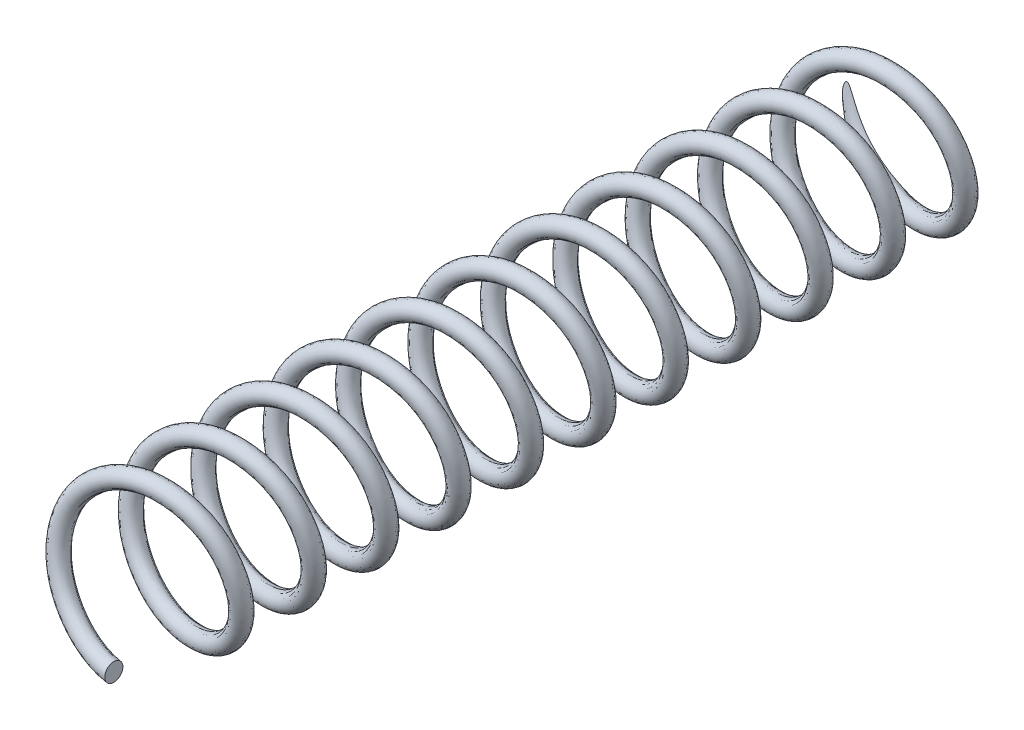
from build123d import *

# Parameters (mm, degrees)
SWEEP1_PITCH       = 1.016
SKETCH16_W         = 43.713001351
SKETCH16_H         = 11.417527284
CUT_EXTRUDE1_DEPTH = 1.27


with BuildPart() as part:
    # Sweep1: the profile of Sketch5 screwed along a right-hand helix of 50 turns, 6 arcs to a turn; built about Z, then put on its axis
    sweep1_z = Axis((0, 0, 0), (0, 0, 1))
    sweep1_corners = [(1.014478483, 0, 0.127), (0.887478483, 0, 0), (1.014478483, 0, -0.127), (1.141478483, 0, 0)]
    with BuildLine(mode=Mode.PRIVATE) as sweep1_profile:
        ThreePointArc((1.014478483, 0, 0.127), (0.924675922, 0, 0.089802561), (0.887478483, 0, 0))
        ThreePointArc((0.887478483, 0, 0), (0.924675922, 0, -0.089802561), (1.014478483, 0, -0.127))
        ThreePointArc((1.014478483, 0, -0.127), (1.104281044, 0, -0.089802561), (1.141478483, 0, 0))
        ThreePointArc((1.141478483, 0, 0), (1.104281044, 0, 0.089802561), (1.014478483, 0, 0.127))
    sweep1_cap = Face(sweep1_profile.wire())
    sweep1_arcs = [((1.014478483, 0, 0.127), (0.887478483, 0, 0.127), (0.887478483, 0, 0), (1, 0.7071067811865476, 1)), ((0.887478483, 0, 0), (0.887478483, 0, -0.127), (1.014478483, 0, -0.127), (1, 0.7071067811865476, 1)), ((1.014478483, 0, -0.127), (1.141478483, 0, -0.127), (1.141478483, 0, 0), (1, 0.7071067811865476, 1)), ((1.141478483, 0, 0), (1.141478483, 0, 0.127), (1.014478483, 0, 0.127), (1, 0.7071067811865476, 1))]  # start, shoulder, end, weights
    sweep1_turn_angles = [0, 30, 60, 90, 120, 150, 180, 210, 240, 270, 300, 330, 360, 390, 420, 450, 480, 510, 540, 570, 600, 630, 660, 690, 720]
    sweep1_turn_weights = [1, 0.8660254037844387, 1, 0.8660254037844387, 1, 0.8660254037844387, 1, 0.8660254037844387, 1, 0.8660254037844387, 1, 0.8660254037844387, 1, 0.8660254037844387, 1, 0.8660254037844387, 1, 0.8660254037844387, 1, 0.8660254037844387, 1, 0.8660254037844387, 1, 0.8660254037844387, 1]
    sweep1_turn_sides = [Face.make_bezier_surface([[Vector(p[j][0], p[j][1], 0).rotate(sweep1_z, sweep1_turn_angles[2 * i + k]) / sweep1_turn_weights[2 * i + k] + Vector(0, 0, p[j][2] + SWEEP1_PITCH * sweep1_turn_angles[2 * i + k] / 360) for k in range(3)] for j in range(3)], [[p[3][j] * sweep1_turn_weights[2 * i + k] for k in range(3)] for j in range(3)]) for p in sweep1_arcs for i in range(12)]
    sweep1 = Plane(origin=(0, 0, 0), x_dir=(0, -1, 0), z_dir=(0, 0, -1)) * Solid(Shell([*[p.moved(Location((0, 0, 2 * SWEEP1_PITCH * i))) for i in range(25) for p in sweep1_turn_sides], sweep1_cap, sweep1_cap.rotate(sweep1_z, 18000).moved(Location((0, 0, SWEEP1_PITCH * 18000 / 360)))]))
    add(sweep1)

    # Sketch16 → Cut-Extrude1 (cut, symmetric)
    with BuildSketch(Plane(origin=(0, 0, 0), x_dir=(0, 0, -1), z_dir=(1, 0, 0))):
        with Locations((33.159500675, -0.956159351)):
            Rectangle(SKETCH16_W, SKETCH16_H)
    extrude(amount=CUT_EXTRUDE1_DEPTH, both=True, mode=Mode.SUBTRACT)


solid = part.part
